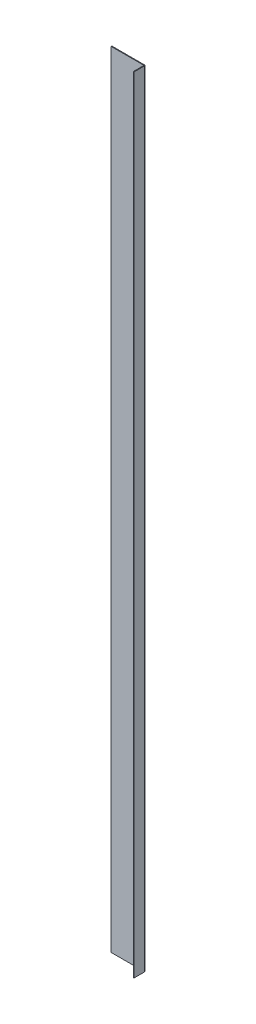
from build123d import *

# Parameters (mm, degrees)
SZKIC1_W                           = 95
SZKIC1_H                           = 2270
ODGI_CIE_BAZOWE1_DEPTH             = 2
ODGI_CIE_KRAW_DZI1_STRIP_W         = 9.4732
ODGI_CIE_KRAW_DZI1_STRIP_H         = 2
ODGI_CIE_KRAW_DZI1_STRIP_CUT_DEPTH = 2270
ODGI_CIE_KRAW_DZI1_DEPTH           = 2270


# Sheet-metal steps are written as plain solids
with BuildPart() as part:
    # Szkic1 → Odgięcie bazowe1 (new body)
    with BuildSketch(Plane.XY):
        with Locations((47.5, 1135)):
            Rectangle(SZKIC1_W, SZKIC1_H)
    extrude(amount=-ODGI_CIE_BAZOWE1_DEPTH)

    # Odgięcie krawędzi1 strip (across the edge) → Odgięcie krawędzi1 strip cut (cut)
    with BuildSketch(Plane(origin=(95, 0, 0), x_dir=(-1, 0, 0), z_dir=(0, 1, 0))):
        with Locations((-4, -1)):
            Rectangle(ODGI_CIE_KRAW_DZI1_STRIP_W, ODGI_CIE_KRAW_DZI1_STRIP_H)
    extrude(amount=ODGI_CIE_KRAW_DZI1_STRIP_CUT_DEPTH, mode=Mode.SUBTRACT)

    # Odgięcie krawędzi1 section (across the edge) → Odgięcie krawędzi1 (add)
    with BuildSketch(Plane(origin=(95, 0, 0), x_dir=(-1, 0, 0), z_dir=(0, 1, 0))):
        with BuildLine():
            Line((-2, 0.7366), (-2, 30.74))
            Line((-2, 30.74), (0, 30.74))
            Line((0, 30.74), (0, 0.7366))
            ThreePointArc((0, 0.7366), (0.215745145, 0.215745145), (0.7366, 0))
            Line((0.7366, 0), (0.7366, -2))
            ThreePointArc((0.7366, -2), (-1.198468417, -1.198468417), (-2, 0.7366))
        make_face()
    extrude(amount=ODGI_CIE_KRAW_DZI1_DEPTH)


solid = part.part
